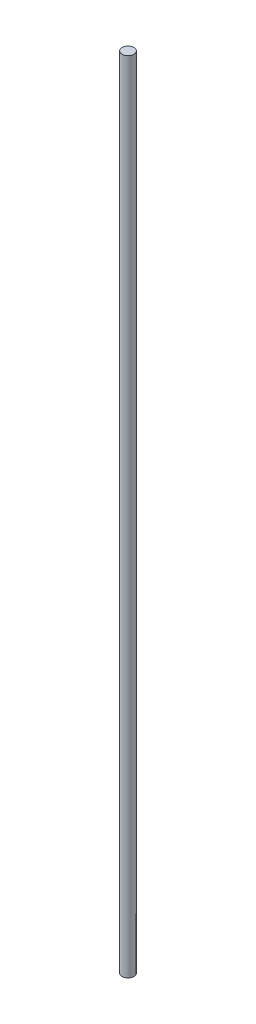
from build123d import *

# Parameters (mm, degrees)
SKETCH1_R           = 4
BOSS_EXTRUDE1_DEPTH = 538


with BuildPart() as part:
    # Sketch1 → Boss-Extrude1 (new body)
    with BuildSketch(Plane(origin=(0, 0, 0), x_dir=(1, 0, 0), z_dir=(0, 1, 0))):
        Circle(SKETCH1_R)
    extrude(amount=BOSS_EXTRUDE1_DEPTH)


solid = part.part
